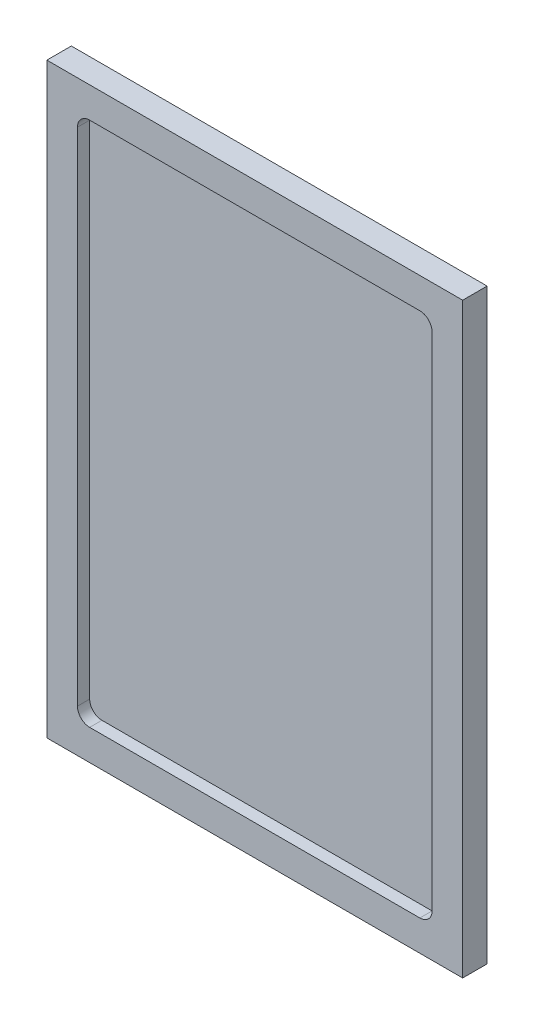
from build123d import *

# Parameters (mm, degrees)
SKETCH1_W           = 215.9
SKETCH1_H           = 304.8
BOSS_EXTRUDE1_DEPTH = 12.7
CUT_EXTRUDE1_DEPTH  = 6.35


with BuildPart() as part:
    # Sketch1 → Boss-Extrude1 (new body)
    with BuildSketch(Plane.XY):
        Rectangle(SKETCH1_W, SKETCH1_H)
    extrude(amount=BOSS_EXTRUDE1_DEPTH)

    # Sketch2 → Cut-Extrude1 (cut)
    with BuildSketch(Plane.XY.offset(12.7)):
        with BuildLine():
            Line((85.725, -136.525), (-85.725, -136.525))
            ThreePointArc((-85.725, -136.525), (-90.215128061, -134.665128061), (-92.075, -130.175))
            Line((-92.075, -130.175), (-92.075, 130.175))
            ThreePointArc((-92.075, 130.175), (-90.215128061, 134.665128061), (-85.725, 136.525))
            Line((-85.725, 136.525), (85.725, 136.525))
            ThreePointArc((85.725, 136.525), (90.215128061, 134.665128061), (92.075, 130.175))
            Line((92.075, 130.175), (92.075, -130.175))
            ThreePointArc((92.075, -130.175), (90.215128061, -134.665128061), (85.725, -136.525))
        make_face()
    extrude(amount=-CUT_EXTRUDE1_DEPTH, mode=Mode.SUBTRACT)


solid = part.part
